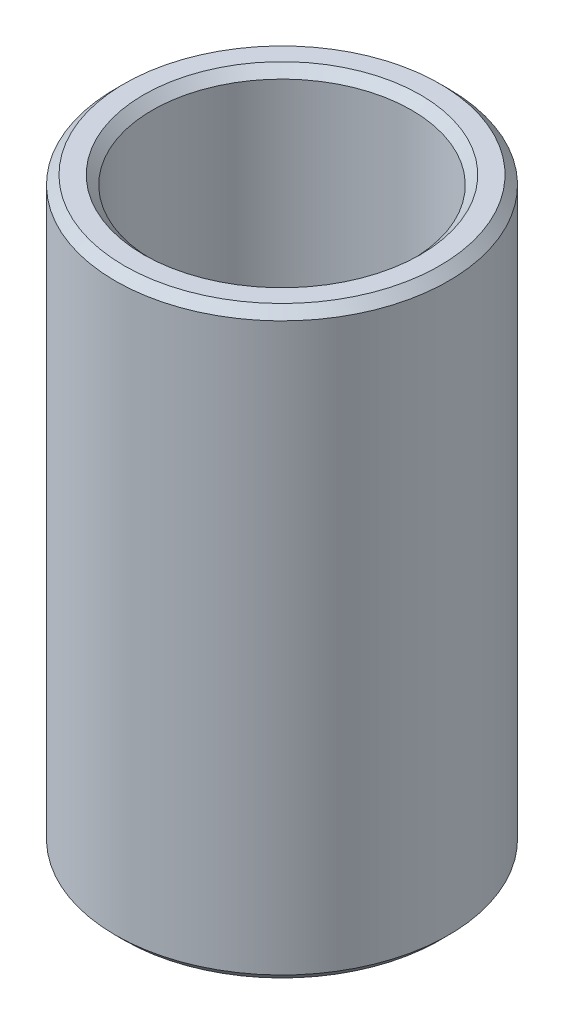
from build123d import *

# Parameters (mm, degrees)
SKETCH1_R           = 50
BOSS_EXTRUDE1_DEPTH = 175.358771011
SKETCH2_R           = 38.910796257
CUT_EXTRUDE1_DEPTH  = 190.078551323
CHAMFER1_SIZE       = 2.65141601


with BuildPart() as part:
    # Sketch1 → Boss-Extrude1 (new body)
    with BuildSketch(Plane(origin=(0, 0, 0), x_dir=(1, 0, 0), z_dir=(0, 1, 0))):
        Circle(SKETCH1_R)
    extrude(amount=BOSS_EXTRUDE1_DEPTH)

    # Sketch2 → Cut-Extrude1 (cut, through all)
    with BuildSketch(Plane(origin=(0, 0, 0), x_dir=(1, 0, 0), z_dir=(0, 1, 0))):
        Circle(SKETCH2_R)
    extrude(amount=CUT_EXTRUDE1_DEPTH, mode=Mode.SUBTRACT)

    # Chamfer1
    chamfer1_edges = [part.edges().sort_by_distance(p)[0] for p in [
        (-38.910796257, 175.358771011, 0),
        (-38.910796257, 0, 0),
        (-50, 0, 0),
        (-50, 175.358771011, 0),
    ]]
    chamfer(chamfer1_edges, length=CHAMFER1_SIZE)


solid = part.part
